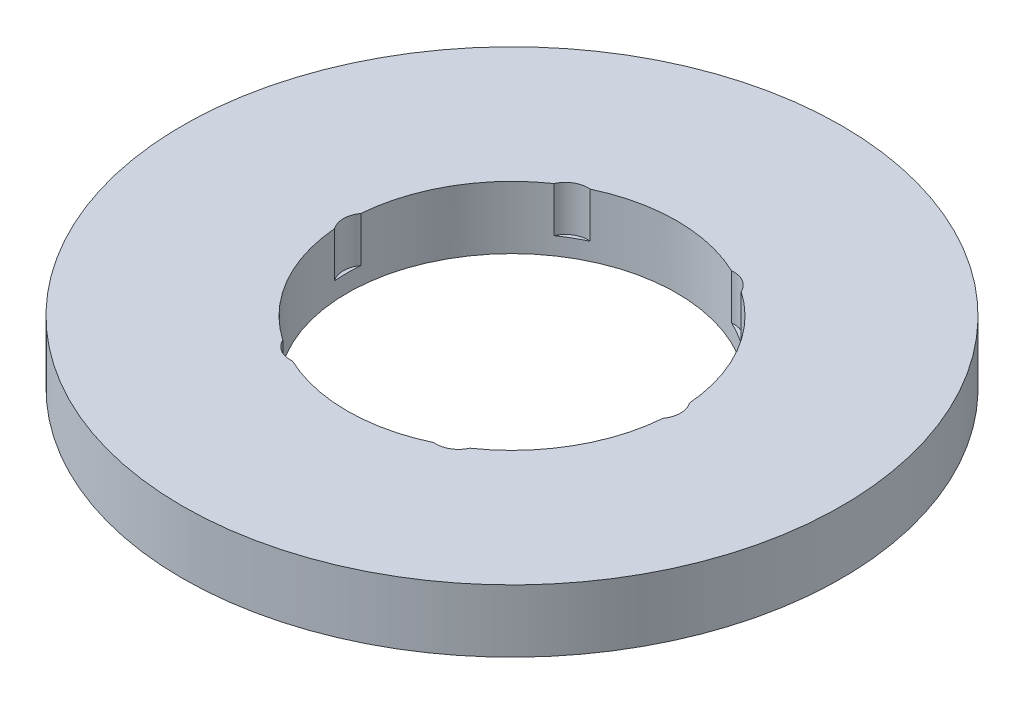
from build123d import *

# Parameters (mm, degrees)
SKETCH1_R           = 100
BOSS_EXTRUDE1_DEPTH = 19
SKETCH2_R           = 50
CUT_EXTRUDE1_DEPTH  = 143.691975948
SKETCH3_R           = 6.812462155
CUT_EXTRUDE2_DEPTH  = 13.698117867
CIRPATTERN1_COUNT   = 6


with BuildPart() as part:
    # Sketch1 → Boss-Extrude1 (new body)
    with BuildSketch(Plane(origin=(0, 0, 0), x_dir=(1, 0, 0), z_dir=(0, 1, 0))):
        Circle(SKETCH1_R)
    extrude(amount=BOSS_EXTRUDE1_DEPTH)

    # Sketch2 → Cut-Extrude1 (cut, through all)
    with BuildSketch(Plane(origin=(0, 0, 0), x_dir=(1, 0, 0), z_dir=(0, 1, 0))):
        Circle(SKETCH2_R)
    extrude(amount=CUT_EXTRUDE1_DEPTH, mode=Mode.SUBTRACT)

    # Sketch3 → Cut-Extrude2 (cut)
    with BuildSketch(Plane(origin=(0, 19, 0), x_dir=(1, 0, 0), z_dir=(0, 1, 0))):
        with Locations((-44.318628805, 0)):
            Circle(SKETCH3_R)
    cut_extrude2 = extrude(amount=-CUT_EXTRUDE2_DEPTH, mode=Mode.SUBTRACT)

    # CirPattern1: Cut-Extrude2 ×6 about axis
    cirpattern1_axis = Axis((0, 0, 0), (0, 1, 0))
    for i in range(1, CIRPATTERN1_COUNT):
        add(cut_extrude2.rotate(cirpattern1_axis, i * 360 / CIRPATTERN1_COUNT), mode=Mode.SUBTRACT)


solid = part.part
